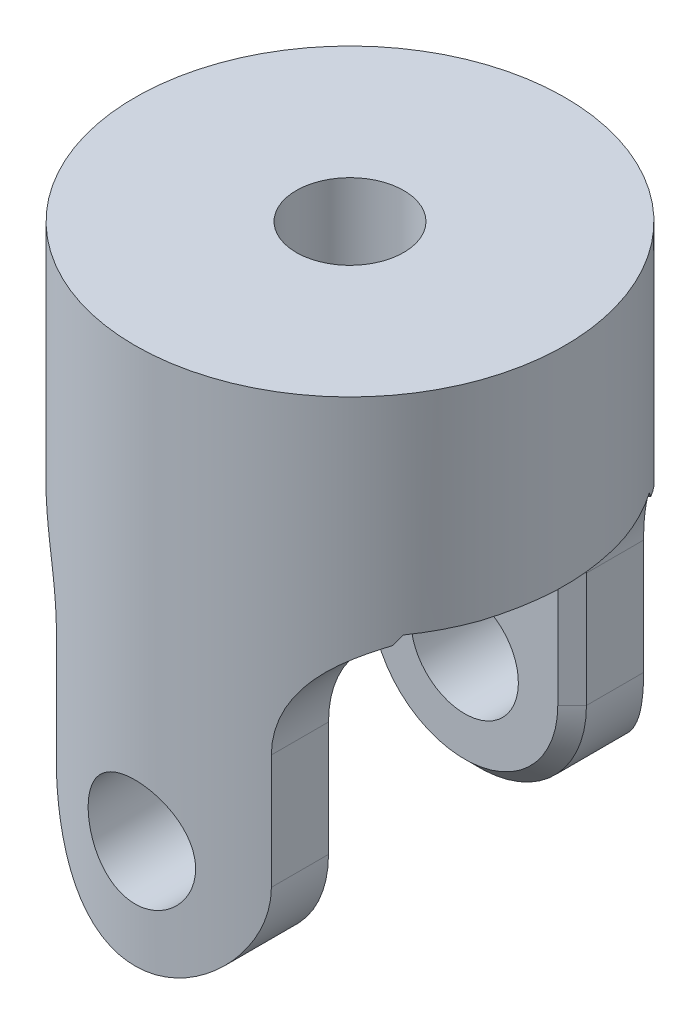
from build123d import *

# Parameters (mm, degrees)
SKETCH1_R               = 19.05
BASE_EXTRUDE_DEPTH      = 47.625
CUT_EXTRUDE1_DEPTH      = 55.716959208
CUT_EXTRUDE1_DEPTH_BACK = 55.716959208
CUT_EXTRUDE5_DEPTH      = 55.716959365
CUT_EXTRUDE5_DEPTH_BACK = 55.716959365
CUT_EXTRUDE6_DEPTH      = 55.716959365
CUT_EXTRUDE6_DEPTH_BACK = 55.716959365
SKETCH11_R              = 4.7625
SKETCH12_R              = 4.7625
CUT_EXTRUDE7_DEPTH      = 55.716959365
CHAMFER1_SIZE           = 1.27


with BuildPart() as part:
    # Sketch1 → Base-Extrude (new body)
    with BuildSketch(Plane(origin=(0, 0, 0), x_dir=(-1, 0, 0), z_dir=(0, 1, 0))):
        with Locations(Location((0, 0, 0), (0, 0, 90))):
            Circle(SKETCH1_R)
    extrude(amount=BASE_EXTRUDE_DEPTH)

    # Sketch2 → Cut-Extrude1 (cut, two sides: drawn at the far end of the back side and taken through both)
    with BuildSketch(Plane.XY.offset(-CUT_EXTRUDE1_DEPTH_BACK)):
        with BuildLine():
            Line((-19.05, -131.979516723), (-19.05, 0))
            Line((-19.05, 0), (-19.05, 29.21))
            ThreePointArc((-19.05, 29.21), (-12.314807909, 26.420192091), (-9.525, 19.685))
            Line((-9.525, 19.685), (-9.525, 9.525))
            ThreePointArc((-9.525, 9.525), (0, 0), (9.525, 9.525))
            Line((9.525, 9.525), (9.525, 19.685))
            ThreePointArc((9.525, 19.685), (12.314807909, 26.420192091), (19.05, 29.21))
            Line((19.05, 29.21), (19.05, 0))
            Line((19.05, 0), (19.05, -131.979516723))
            Line((19.05, -131.979516723), (19.05, -395.938550169))
            Line((19.05, -395.938550169), (-19.05, -395.938550169))
            Line((-19.05, -395.938550169), (-19.05, -131.979516723))
        make_face()
    extrude(amount=CUT_EXTRUDE1_DEPTH + CUT_EXTRUDE1_DEPTH_BACK, mode=Mode.SUBTRACT)

    # Sketch8 → Cut-Extrude5 (cut, two sides: drawn at the far end of the back side and taken through both)
    with BuildSketch(Plane(origin=(0, 0, 0), x_dir=(0, 0, -1), z_dir=(1, 0, 0)).offset(-CUT_EXTRUDE5_DEPTH_BACK)):
        Polygon((-10.16, -121.738350451), (-10.16, 0), (-10.16, 29.145238826), (10.16, 29.145238826), (10.16, 0), (10.16, -121.738350451), (10.16, -365.215051352), (-10.16, -365.215051352), align=None)
    extrude(amount=CUT_EXTRUDE5_DEPTH + CUT_EXTRUDE5_DEPTH_BACK, mode=Mode.SUBTRACT)

    # Sketch11 → Cut-Extrude6 (cut, two sides: drawn at the far end of the back side and taken through both)
    with BuildSketch(Plane.XY.offset(-CUT_EXTRUDE6_DEPTH_BACK)):
        with Locations(Location((0, 9.525, 0), (0, 0, 90))):
            Circle(SKETCH11_R)
    extrude(amount=CUT_EXTRUDE6_DEPTH + CUT_EXTRUDE6_DEPTH_BACK, mode=Mode.SUBTRACT)

    # Sketch12 → Cut-Extrude7 (cut, through all)
    with BuildSketch(Plane(origin=(0, 47.625, 0), x_dir=(-1, 0, 0), z_dir=(0, 1, 0))):
        with Locations(Location((0, 0, 0), (0, 0, 90))):
            Circle(SKETCH12_R)
    extrude(amount=-CUT_EXTRUDE7_DEPTH, mode=Mode.SUBTRACT)

    # Chamfer1
    # the kernel refuses this chamfer: 1.27 mm, written as the material it takes off along each edge
    with BuildSketch(Plane(origin=(19.05, 19.685, -10.16), x_dir=(-1, 0, 0), z_dir=(0, -1, 0))) as chamfer1_piece_1_section:
        Polygon((9.525 + CHAMFER1_SIZE, 0), (9.525, CHAMFER1_SIZE), (9.525, 0), align=None)
    chamfer1_piece_1 = revolve(axis=Axis((19.05, 19.685, -10.16), (0, 0, -1)), revolution_arc=91.701103325, mode=Mode.PRIVATE)
    chamfer1_piece_1 = split(chamfer1_piece_1, bisect_by=Plane(origin=(9.159628587, 29.145238826, -10.520330591), z_dir=(0, -1, 0)), keep=Keep.TOP, mode=Mode.PRIVATE)
    add(chamfer1_piece_1, mode=Mode.SUBTRACT)
    with BuildSketch(Plane(origin=(9.525, 19.685, -10.16), x_dir=(-0.9996219169112966, 0, 0.027495876610585942), z_dir=(0, -1, 0)), Plane(origin=(-9.525, 9.525, -10.16), x_dir=(0.9996219169112966, 0, 0.027495876610585942), z_dir=(0, 1, 0)), Plane(origin=(-9.525, 19.685, 10.16), x_dir=(0.9996219169112966, 0, -0.027495876610585942), z_dir=(0, -1, 0))) as chamfer1_piece_2:
        Polygon((CHAMFER1_SIZE * 0.999621916911, CHAMFER1_SIZE * 0.0274958766106), (-CHAMFER1_SIZE * 0.0274958766106, CHAMFER1_SIZE * 0.999621916911), (0, 0), align=None)
    extrude(amount=10.16, mode=Mode.SUBTRACT)
    with BuildSketch(Plane(origin=(0, 9.525, -10.16), x_dir=(1, 0, 0), z_dir=(0, 1, 0))) as chamfer1_piece_3:
        Polygon((9.525 - CHAMFER1_SIZE, 0), (9.525, CHAMFER1_SIZE), (9.525, 0), align=None)
    revolve(axis=Axis((0, 9.525, -10.16), (0, 0, -1)), revolution_arc=180, mode=Mode.SUBTRACT)
    with BuildSketch(Plane(origin=(-19.05, 19.685, -10.16), x_dir=(-0.029685492056236547, 0.9995592886674503, 0), z_dir=(-0.9995592886674503, -0.029685492056236547, 0))) as chamfer1_piece_4_section:
        Polygon((9.525 + CHAMFER1_SIZE, 0), (9.525, CHAMFER1_SIZE), (9.525, 0), align=None)
    chamfer1_piece_4 = revolve(axis=Axis((-19.05, 19.685, -10.16), (0, 0, -1)), revolution_arc=91.701103313, mode=Mode.PRIVATE)
    chamfer1_piece_4 = split(chamfer1_piece_4, bisect_by=Plane(origin=(-11.981482464, 29.145238826, -10.596388044), z_dir=(0, -1, 0)), keep=Keep.TOP, mode=Mode.PRIVATE)
    add(chamfer1_piece_4, mode=Mode.SUBTRACT)
    with BuildSketch(Plane(origin=(19.05, 19.685, 10.16), x_dir=(-1, 0, 0), z_dir=(0, -1, 0))) as chamfer1_piece_5_section:
        Polygon((9.525, -CHAMFER1_SIZE), (9.525 + CHAMFER1_SIZE, 0), (9.525, 0), align=None)
    chamfer1_piece_5 = revolve(axis=Axis((19.05, 19.685, 10.16), (0, 0, -1)), revolution_arc=91.701103313, mode=Mode.PRIVATE)
    chamfer1_piece_5 = split(chamfer1_piece_5, bisect_by=Plane(origin=(11.981482474, 29.145238826, 10.59638804), z_dir=(0, -1, 0)), keep=Keep.TOP, mode=Mode.PRIVATE)
    add(chamfer1_piece_5, mode=Mode.SUBTRACT)
    with BuildSketch(Plane(origin=(9.525, 9.525, 10.16), x_dir=(0.02749587661058595, 0, 0.9996219169112968), z_dir=(0, 1, 0))) as chamfer1_piece_6:
        Polygon((CHAMFER1_SIZE * 0.999621916911, -CHAMFER1_SIZE * 0.0274958766106), (-CHAMFER1_SIZE * 0.0274958766106, -CHAMFER1_SIZE * 0.999621916911), (0, 0), align=None)
    extrude(amount=10.16, mode=Mode.SUBTRACT)
    with BuildSketch(Plane(origin=(0, 9.525, 10.16), x_dir=(1, 0, 0), z_dir=(0, 1, 0))) as chamfer1_piece_7:
        Polygon((9.525, -CHAMFER1_SIZE), (9.525 - CHAMFER1_SIZE, 0), (9.525, 0), align=None)
    revolve(axis=Axis((0, 9.525, 10.16), (0, 0, -1)), revolution_arc=180, mode=Mode.SUBTRACT)
    with BuildSketch(Plane(origin=(-19.05, 19.685, 10.16), x_dir=(-0.02968549226478587, 0.9995592886612565, 0), z_dir=(-0.9995592886612565, -0.02968549226478587, 0))) as chamfer1_piece_8_section:
        Polygon((9.525 + CHAMFER1_SIZE, 0), (9.525, -CHAMFER1_SIZE), (9.525, 0), align=None)
    chamfer1_piece_8 = revolve(axis=Axis((-19.05, 19.685, 10.16), (0, 0, -1)), revolution_arc=91.701103325, mode=Mode.PRIVATE)
    chamfer1_piece_8 = split(chamfer1_piece_8, bisect_by=Plane(origin=(-11.981482467, 29.145238826, 10.596388044), z_dir=(0, -1, 0)), keep=Keep.TOP, mode=Mode.PRIVATE)
    add(chamfer1_piece_8, mode=Mode.SUBTRACT)


solid = part.part
